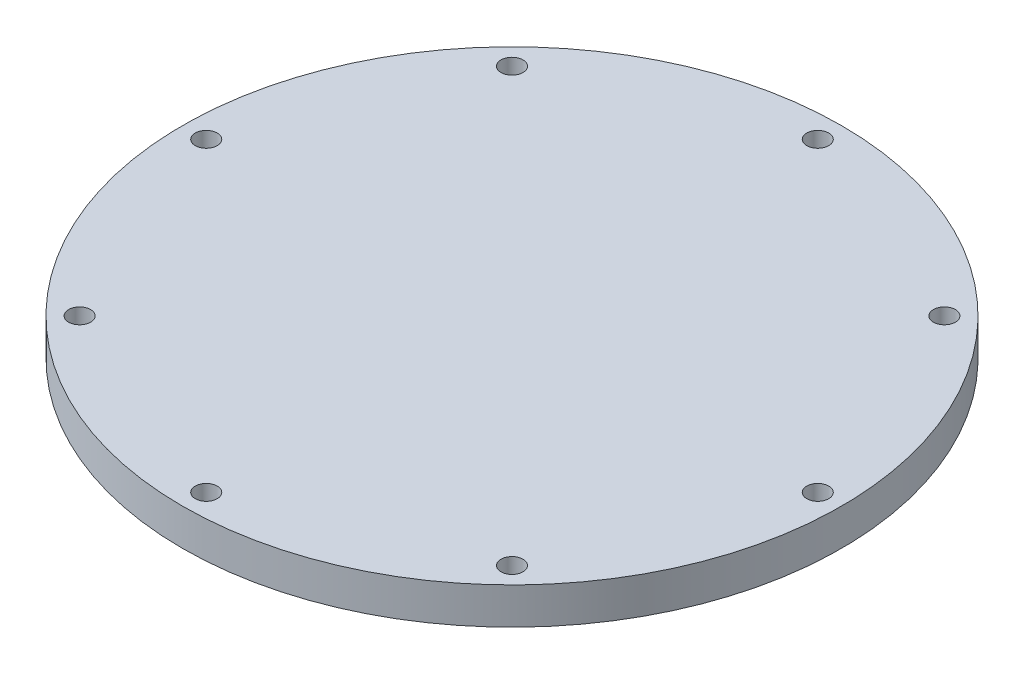
from build123d import *

# Parameters (mm, degrees)
SKETCH1_R           = 45
SKETCH1_R_2         = 1.5
BOSS_EXTRUDE2_DEPTH = 5


with BuildPart() as part:
    # Sketch1 → Boss-Extrude2 (new body)
    with BuildSketch(Plane(origin=(0, 0, 0), x_dir=(1, 0, 0), z_dir=(0, 1, 0))):
        Circle(SKETCH1_R)
        with Locations((0, 41.75)):
            Circle(SKETCH1_R_2, mode=Mode.SUBTRACT)
        with Locations((29.521708115, 29.521708115)):
            Circle(SKETCH1_R_2, mode=Mode.SUBTRACT)
        with Locations((41.75, 0)):
            Circle(SKETCH1_R_2, mode=Mode.SUBTRACT)
        with Locations((29.521708115, -29.521708115)):
            Circle(SKETCH1_R_2, mode=Mode.SUBTRACT)
        with Locations((0, -41.75)):
            Circle(SKETCH1_R_2, mode=Mode.SUBTRACT)
        with Locations((-29.521708115, -29.521708115)):
            Circle(SKETCH1_R_2, mode=Mode.SUBTRACT)
        with Locations((-41.75, 0)):
            Circle(SKETCH1_R_2, mode=Mode.SUBTRACT)
        with Locations((-29.521708115, 29.521708115)):
            Circle(SKETCH1_R_2, mode=Mode.SUBTRACT)
    extrude(amount=BOSS_EXTRUDE2_DEPTH)


solid = part.part
